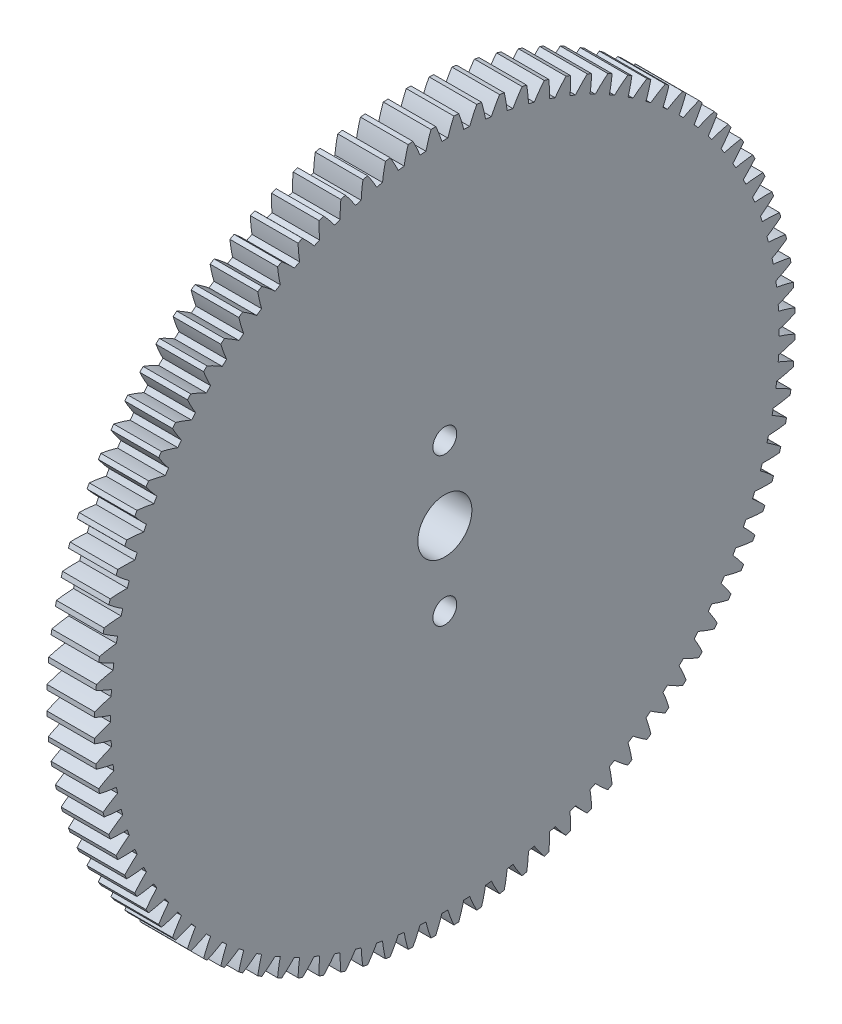
from build123d import *

# Parameters (mm, degrees)
BASPROSKE_W     = 2
BASPROSKE_H     = 44.1
TOOTHCUT_DEPTH  = 63.398878195
TEETHCUTS_COUNT = 96
TEETHCUTS_ANGLE = 356.25
BORSKE_R        = 3.4
BORSKE_R_2      = 1.5
BORE_DEPTH      = 50.0000508
SCALE1_SCALE_X  = 3
SCALE1_SCALE_Y  = 1
SCALE1_SCALE_Z  = 1


with BuildPart() as part:
    # BasProSke → Base-Revolve (revolve)
    with BuildSketch(Plane(origin=(0, 0, 0), x_dir=(1, 0, 0), z_dir=(0, 1, 0))):
        with Locations((1, 22.05)):
            Rectangle(BASPROSKE_W, BASPROSKE_H)
    revolve(axis=Axis((-10, 0, 0), (1, 0, 0)))

    # TooCutSke → ToothCut (cut, through all)
    with BuildSketch(Plane(origin=(0, 0, 0), x_dir=(0, 0, -1), z_dir=(1, 0, 0))):
        with BuildLine():
            ThreePointArc((0.373727517, 42.072340127), (0, 42.074), (-0.373727517, 42.072340127))
            ThreePointArc((-0.373727517, 42.072340127), (-0.731746974, 43.103654053), (-1.154174229, 44.110302731))
            ThreePointArc((-1.154174229, 44.110302731), (0, 44.1254), (1.154174229, 44.110302731))
            ThreePointArc((1.154174229, 44.110302731), (0.731746974, 43.103654053), (0.373727517, 42.072340127))
        make_face()
    toothcut = extrude(amount=TOOTHCUT_DEPTH, mode=Mode.SUBTRACT)

    # TeethCuts: ToothCut ×96 about axis
    teethcuts_axis = Axis((-10, 0, 0), (1, 0, 0))
    for i in range(1, TEETHCUTS_COUNT):
        add(toothcut.rotate(teethcuts_axis, i * TEETHCUTS_ANGLE / (TEETHCUTS_COUNT - 1)), mode=Mode.SUBTRACT)

    # BorSke → Bore (cut, symmetric)
    with BuildSketch(Plane(origin=(0, 0, 0), x_dir=(0, 0, -1), z_dir=(1, 0, 0))):
        Circle(BORSKE_R)
        with Locations((0, -9.3)):
            Circle(BORSKE_R_2)
        with Locations((0, 9.3)):
            Circle(BORSKE_R_2)
    extrude(amount=BORE_DEPTH, both=True, mode=Mode.SUBTRACT)


with BuildPart() as part_1:
    # Scale1: scaled about (1, 0, 0)
    add(part.part.scale((SCALE1_SCALE_X, SCALE1_SCALE_Y, SCALE1_SCALE_Z), about=(1, 0, 0)))


solid = part_1.part
